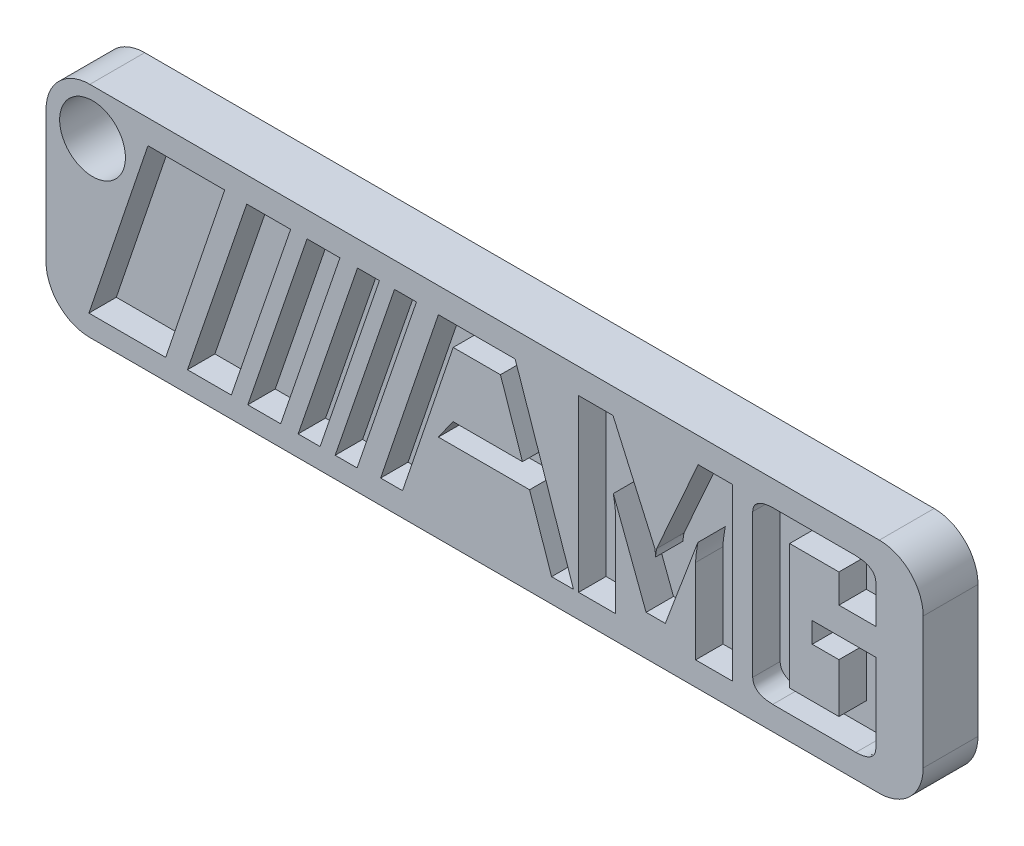
from build123d import *

# Parameters (mm, degrees)
ESQUISSE1_W                  = 80
ESQUISSE1_H                  = 20
BOSS_EXTRU_1_DEPTH           = 5
CONG_1_R                     = 4
ENL_V_MAT_EXTRU_1_DEPTH      = 83.613558209
ENL_V_START                  = -5
ENL_V_MAT_EXTRU_2_DEPTH      = 5
ESQUISSE11_W                 = 13.611032385
ESQUISSE11_H                 = 17.64061434
BOSS_EXTRU_8_DEPTH           = 5
ENL_V_MAT_EXTRU_3_DEPTH      = 83.613558336
ENL_V_MAT_EXTRU_3_DEPTH_BACK = 83.613558336
ESQUISSE13_R                 = 3
ENL_V_MAT_EXTRU_4_DEPTH      = 33
BOSS_EXTRU_9_DEPTH           = 2.5


# Read off the part's stored shape, not the designer's step: Enlèv. mat.-Extru.2
with BuildPart() as part:
    # Esquisse1 → Boss.-Extru.1 (new body)
    with BuildSketch(Plane.XY):
        with Locations((40, -10)):
            Rectangle(ESQUISSE1_W, ESQUISSE1_H)
    extrude(amount=BOSS_EXTRU_1_DEPTH)

    # Congé1
    cong_1_edges = [part.edges().sort_by_distance(p)[0] for p in [
        (0, 0, 2.5),
        (80, 0, 2.5),
        (80, -20, 2.5),
        (0, -20, 2.5),
    ]]
    fillet(cong_1_edges, radius=CONG_1_R)

    # Esquisse2 → Enlèv. mat.-Extru.1 (cut, through all)
    with BuildSketch(Plane.XY.offset(5)):
        Polygon((28.410040172, -2.300084773), (30.410040172, -2.300084773), (24.995829866, -18.113699025), (22.995829866, -18.113699025), align=None)
        Polygon((9.298142424, -2.198086037), (16.298142424, -2.198086037), (10.914062948, -18.113699025), (3.914062948, -18.113699025), align=None)
        Polygon((18.309829725, -2.300084773), (22.309829725, -2.300084773), (16.902589817, -18.093340154), (12.902589817, -18.093340154), align=None)
        Polygon((23.808061727, -2.300084773), (26.808061727, -2.300084773), (21.404325417, -18.111661936), (18.404325417, -18.111661936), align=None)
        Polygon((31.786127586, -2.300084773), (33.786127586, -2.300084773), (28.371917279, -18.113699025), (26.371917279, -18.113699025), align=None)
    extrude(amount=-ENL_V_MAT_EXTRU_1_DEPTH, mode=Mode.SUBTRACT)

    # Enlèv. mat.-Extru.2 outline → Enlèv. mat.-Extru.2 (cut)
    # profile 1 of 3: a face of its own
    with BuildSketch(Plane.XY.offset(5).offset(ENL_V_START)):
        with BuildLine():
            add(Edge.make_bspline(
                [(75.686567024, -16.611023442), (75.678643784, -16.704663886), (75.663447013, -16.884266233), (75.563839443, -17.132408637), (75.415616385, -17.347383223), (75.204262037, -17.518269705), (74.945020643, -17.657920052), (74.629763147, -17.753299102), (74.263391467, -17.817731699), (74.000846179, -17.830167685), (73.861085096, -17.83678775)],
                knots=[0, 0, 0, 0, 0.114098337, 0.218840581, 0.322174175, 0.429434412, 0.547100708, 0.679564678, 0.829422238, 1, 1, 1, 1], degree=3))
            Line((75.686567024, -16.611023442), (75.686567024, -9.411486545))
            Line((75.686567024, -9.411486545), (69.882470639, -9.411486545))
            Line((69.882470639, -9.411486545), (69.882470639, -11.283775701))
            Line((69.882470639, -11.283775701), (72.316446542, -11.283775701))
            Line((72.316446542, -11.283775701), (72.316446542, -15.777269677))
            Line((72.316446542, -15.777269677), (67.822952566, -15.777269677))
            Line((67.822952566, -15.777269677), (67.822952566, -4.356305822))
            Line((67.822952566, -4.356305822), (72.316446542, -4.356305822))
            Line((72.316446542, -4.356305822), (72.316446542, -6.977510641))
            Line((72.316446542, -6.977510641), (75.686567024, -6.977510641))
            Line((75.686567024, -6.977510641), (75.686567024, -3.522552057))
            add(Edge.make_bspline(
                [(73.861085096, -2.29678775), (74.000846179, -2.303407815), (74.263391467, -2.3158438), (74.629763147, -2.380276397), (74.945020643, -2.475655447), (75.204262037, -2.615305794), (75.415616385, -2.786192276), (75.563839443, -3.001166862), (75.663447013, -3.249309266), (75.678643784, -3.428911613), (75.686567024, -3.522552057)],
                knots=[0, 0, 0, 0, 0.170577762, 0.320435322, 0.452899292, 0.570565588, 0.677825825, 0.781159419, 0.885901663, 1, 1, 1, 1], degree=3))
            Line((73.861085096, -2.29678775), (66.322195789, -2.29678775))
            add(Edge.make_bspline(
                [(64.452832084, -3.522552057), (64.460490101, -3.428813179), (64.475207603, -3.248661832), (64.578900626, -3.001012416), (64.72992953, -2.785012839), (64.947387079, -2.615412784), (65.212124175, -2.475706721), (65.534969931, -2.379572165), (65.910264022, -2.316247539), (66.179534857, -2.303527098), (66.322195789, -2.29678775)],
                knots=[0, 0, 0, 0, 0.112348161, 0.215915455, 0.318343111, 0.425762474, 0.543690884, 0.676356302, 0.828532073, 1, 1, 1, 1], degree=3))
            Line((64.452832084, -3.522552057), (64.452832084, -16.611023442))
            add(Edge.make_bspline(
                [(66.278314012, -17.83678775), (66.138552929, -17.830167685), (65.876007642, -17.817731699), (65.509635961, -17.753299102), (65.194378466, -17.657920052), (64.935137072, -17.518269705), (64.723782723, -17.347383223), (64.575559665, -17.132408637), (64.475952096, -16.884266233), (64.460755324, -16.704663886), (64.452832084, -16.611023442)],
                knots=[0, 0, 0, 0, 0.170577762, 0.320435322, 0.452899292, 0.570565588, 0.677825825, 0.781159419, 0.885901663, 1, 1, 1, 1], degree=3))
            Line((66.278314012, -17.83678775), (73.861085096, -17.83678775))
        make_face()
    # profile 2 of 3: a face of its own
    with BuildSketch(Plane.XY.offset(5).offset(ENL_V_START)):
        with BuildLine():
            add(Edge.make_bspline(
                [(59.247868229, -10.142849497), (59.250113416, -10.031576234), (59.255029992, -9.787906808), (59.301768342, -9.394005261), (59.364432817, -8.9400039), (59.423938248, -8.619443962), (59.455575307, -8.4490129)],
                knots=[0, 0, 0, 0, 0.195301478, 0.427676852, 0.695714808, 1, 1, 1, 1], degree=3))
            Line((59.247868229, -10.142849497), (59.247868229, -17.83678775))
            Line((59.247868229, -17.83678775), (62.617988711, -17.83678775))
            Line((62.617988711, -17.83678775), (62.617988711, -2.29678775))
            Line((62.617988711, -2.29678775), (59.481904374, -2.29678775))
            Line((59.481904374, -2.29678775), (55.68759338, -10.836181575))
            add(Edge.make_bspline(
                [(55.596904374, -11.538290009), (55.59815665, -11.492405908), (55.600881716, -11.392557927), (55.62162629, -11.229918497), (55.645376833, -11.040932864), (55.672949182, -10.907206292), (55.68759338, -10.836181575)],
                knots=[0, 0, 0, 0, 0.19413449, 0.422454333, 0.693254547, 1, 1, 1, 1], degree=3))
            add(Edge.make_bspline(
                [(55.506215368, -10.836181575), (55.516865461, -10.868148772), (55.54346006, -10.947974815), (55.561126156, -11.099283482), (55.582536457, -11.300899182), (55.59176432, -11.45336457), (55.596904374, -11.538290009)],
                knots=[0, 0, 0, 0, 0.142095852, 0.354830918, 0.640631437, 1, 1, 1, 1], degree=3))
            Line((55.506215368, -10.836181575), (51.711904374, -2.29678775))
            Line((51.711904374, -2.29678775), (48.575820036, -2.29678775))
            Line((48.575820036, -2.29678775), (48.575820036, -17.83678775))
            Line((48.575820036, -17.83678775), (51.945940518, -17.83678775))
            Line((51.945940518, -17.83678775), (51.945940518, -10.142849497))
            add(Edge.make_bspline(
                [(51.741158892, -8.4490129), (51.77262663, -8.62239324), (51.831532725, -8.946952903), (51.895555168, -9.402629403), (51.938009232, -9.793916754), (51.94345609, -10.033548389), (51.945940518, -10.142849497)],
                knots=[0, 0, 0, 0, 0.309420385, 0.579220093, 0.808073296, 1, 1, 1, 1], degree=3))
            Line((51.741158892, -8.4490129), (54.728045187, -16.338956424))
            Line((54.728045187, -16.338956424), (56.480390819, -16.338956424))
            Line((56.480390819, -16.338956424), (59.455575307, -8.4490129))
        make_face()
    # profile 3 of 3: a face of its own
    with BuildSketch(Plane.XY.offset(5).offset(ENL_V_START)):
        Polygon((44.119771843, -17.83678775), (47.489892325, -17.83678775), (43.019801964, -2.29678775), (39.439048952, -2.29678775), (34.945554976, -17.795831424), (34.945554976, -17.83678775), (38.315675458, -17.83678775), (39.023634795, -15.028354015), (43.41766341, -15.028354015), align=None)
        Polygon((41.217723651, -5.921422539), (42.923262054, -12.968835942), (39.488781633, -12.968835942), align=None, mode=Mode.SUBTRACT)
    extrude(amount=ENL_V_MAT_EXTRU_2_DEPTH, mode=Mode.SUBTRACT)

    # Esquisse11 → Boss.-Extru.8 (add)
    with BuildSketch(Plane.XY.offset(5)):
        with Locations((41.097921838, -10.121676789)):
            Rectangle(ESQUISSE11_W, ESQUISSE11_H)
    extrude(amount=-BOSS_EXTRU_8_DEPTH)

    # Esquisse12 → Enlèv. mat.-Extru.3 (cut, two sides: drawn at the far end of the back side and taken through both)
    with BuildSketch(Plane.XY.offset(5).offset(-ENL_V_MAT_EXTRU_3_DEPTH_BACK)):
        Polygon((35.786127586, -2.300084773), (42.786127586, -2.300084773), (48.111179633, -17.834694794), (46.111179633, -17.834694794), (44.102998893, -11.969278829), (35.786127586, -11.969278829), (37.115967439, -10.077108111), (43.455164056, -10.077108111), (41.446983316, -4.211692145), (37.138004335, -4.211692145), (32.518467193, -17.83678775), (30.518467193, -17.83678775), align=None)
    extrude(amount=ENL_V_MAT_EXTRU_3_DEPTH + ENL_V_MAT_EXTRU_3_DEPTH_BACK, mode=Mode.SUBTRACT)

    # Esquisse13 → Enlèv. mat.-Extru.4 (cut)
    with BuildSketch(Plane.XY.offset(5)):
        with Locations((4.24401363, -4.167068495)):
            Circle(ESQUISSE13_R)
    extrude(amount=-ENL_V_MAT_EXTRU_4_DEPTH, mode=Mode.SUBTRACT)

    # Esquisse14 → Boss.-Extru.9 (add)
    with BuildSketch(Plane(origin=(0, 0, 0), x_dir=(-1, 0, 0), z_dir=(0, 0, -1))):
        Polygon((-76.993137328, -1.775197305), (-76.993137328, -18.151298047), (-3.246627444, -18.151298047), (-8.832660873, -1.775197305), align=None)
    extrude(amount=-BOSS_EXTRU_9_DEPTH)


solid = part.part
